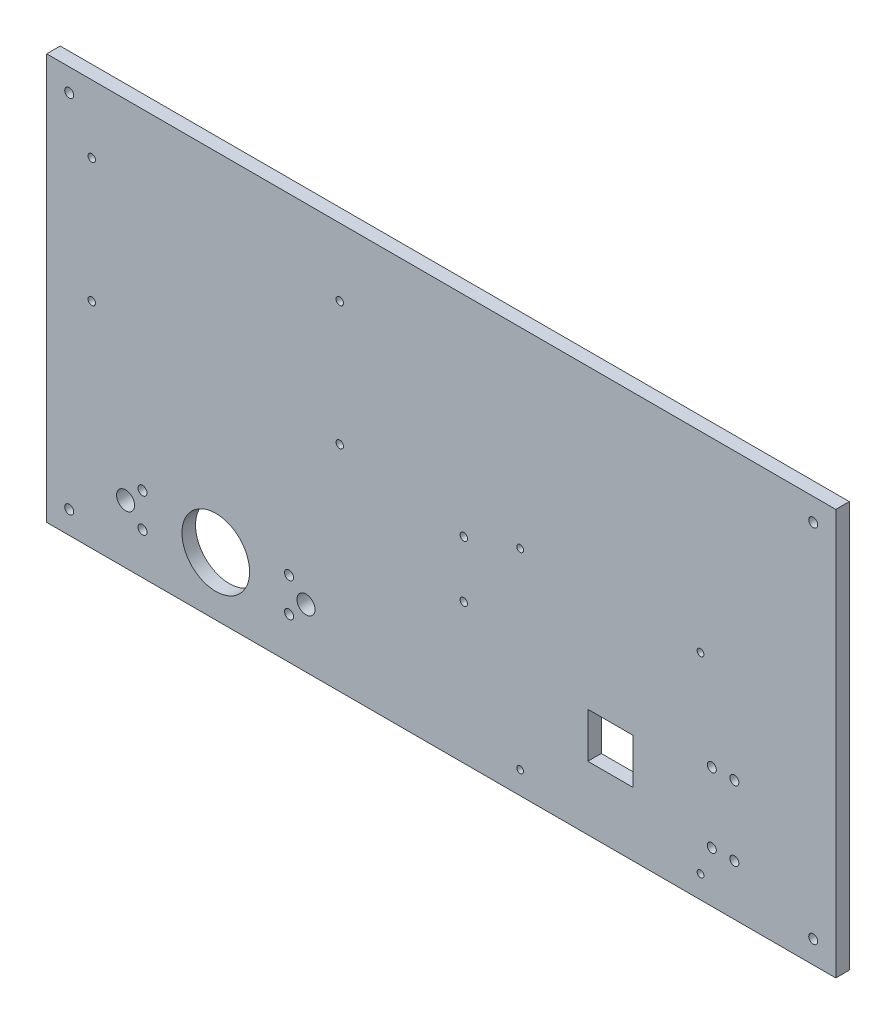
from build123d import *

# Parameters (mm, degrees)
ESBO_O1_W                = 350
ESBO_O1_H                = 180
ESBO_O1_R                = 2
ESBO_O1_R_2              = 4
ESBO_O1_R_3              = 15
ESBO_O1_R_4              = 1.5
ESBO_O1_W_2              = 20
ESBO_O1_H_2              = 20
ESBO_O1_R_5              = 1.65
RESSALTO_EXTRUS_O1_DEPTH = 6
ESBO_O2_R                = 2
CORTE_EXTRUS_O1_DEPTH    = 10
ESBO_O3_R                = 2
CORTE_EXTRUS_O2_DEPTH    = 10


with BuildPart() as part:
    # Esboço1 → Ressalto-extrusão1 (new body)
    with BuildSketch(Plane.XY):
        Rectangle(ESBO_O1_W, ESBO_O1_H)
        with Locations((-132.5, -71.5)):
            Circle(ESBO_O1_R, mode=Mode.SUBTRACT)
        with Locations((-140, -64)):
            Circle(ESBO_O1_R_2, mode=Mode.SUBTRACT)
        with Locations((-132.5, -56.5)):
            Circle(ESBO_O1_R, mode=Mode.SUBTRACT)
        with Locations((-100, -64)):
            Circle(ESBO_O1_R_3, mode=Mode.SUBTRACT)
        with Locations((-67.5, -71.5)):
            Circle(ESBO_O1_R, mode=Mode.SUBTRACT)
        with Locations((-67.5, -56.5)):
            Circle(ESBO_O1_R, mode=Mode.SUBTRACT)
        with Locations((-60, -64)):
            Circle(ESBO_O1_R_2, mode=Mode.SUBTRACT)
        with Locations((35, -80)):
            Circle(ESBO_O1_R_4, mode=Mode.SUBTRACT)
        with Locations((75, -51.75)):
            Rectangle(ESBO_O1_W_2, ESBO_O1_H_2, mode=Mode.SUBTRACT)
        with Locations((115, -80)):
            Circle(ESBO_O1_R_4, mode=Mode.SUBTRACT)
        with Locations((10, -28)):
            Circle(ESBO_O1_R_5, mode=Mode.SUBTRACT)
        with Locations((10, -3)):
            Circle(ESBO_O1_R_5, mode=Mode.SUBTRACT)
        with Locations((-155, 5)):
            Circle(ESBO_O1_R_5, mode=Mode.SUBTRACT)
        with Locations((-45, 5)):
            Circle(ESBO_O1_R_5, mode=Mode.SUBTRACT)
        with Locations((-155, 60)):
            Circle(ESBO_O1_R_5, mode=Mode.SUBTRACT)
        with Locations((-45, 60)):
            Circle(ESBO_O1_R_5, mode=Mode.SUBTRACT)
        with Locations((35, 5)):
            Circle(ESBO_O1_R_4, mode=Mode.SUBTRACT)
        with Locations((115, 5)):
            Circle(ESBO_O1_R_4, mode=Mode.SUBTRACT)
    extrude(amount=RESSALTO_EXTRUS_O1_DEPTH)

    # Esboço2 → Corte-extrusão1 (cut)
    with BuildSketch(Plane.XY.offset(6)):
        with Locations((165, -80)):
            Circle(ESBO_O2_R)
        with Locations((165, 80)):
            Circle(ESBO_O2_R)
        with Locations((-165, 80)):
            Circle(ESBO_O2_R)
        with Locations((-165, -80)):
            Circle(ESBO_O2_R)
    extrude(amount=-CORTE_EXTRUS_O1_DEPTH, mode=Mode.SUBTRACT)

    # Esboço3 → Corte-extrusão2 (cut)
    with BuildSketch(Plane.XY.offset(6)):
        with Locations((130, -67.5)):
            Circle(ESBO_O3_R)
        with Locations((130, -36.5)):
            Circle(ESBO_O3_R)
        with Locations((120, -36.5)):
            Circle(ESBO_O3_R)
        with Locations((120, -67.5)):
            Circle(ESBO_O3_R)
    extrude(amount=-CORTE_EXTRUS_O2_DEPTH, mode=Mode.SUBTRACT)


solid = part.part
